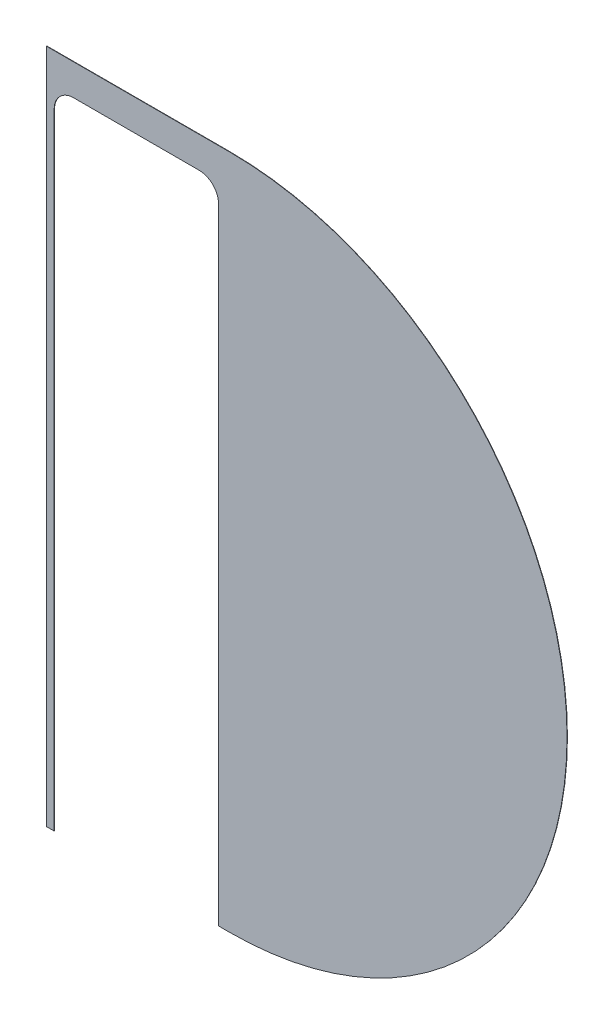
from build123d import *

# Parameters (mm, degrees)
BOSS_EXTRUDE1_DEPTH = 1
CUT_EXTRUDE1_DEPTH  = 2243.543822363


with BuildPart() as part:
    # Sketch1 → Boss-Extrude1 (new body)
    with BuildSketch(Plane.XY):
        with BuildLine():
            Line((0, 0), (470, 0))
            ThreePointArc((470, 0), (1340, 870), (470, 1740))
            Line((470, 1740), (0, 1740))
            Line((0, 1740), (0, 0))
        make_face()
    extrude(amount=BOSS_EXTRUDE1_DEPTH)

    # Sketch2 → Cut-Extrude1 (cut, through all)
    with BuildSketch(Plane(origin=(-149.893544062, 64.252100529, -32), x_dir=(-1, 0, 0), z_dir=(0, 0, -1))):
        with BuildLine():
            Line((-592.773575067, -114.252100529), (-169.572129607, -114.252100529))
            Line((-169.572129607, -114.252100529), (-169.572129607, 1545.594593054))
            ThreePointArc((-169.572129607, 1545.594593054), (-184.216790548, 1580.949932113), (-219.572129607, 1595.594593054))
            Line((-219.572129607, 1595.594593054), (-542.773575067, 1595.594593054))
            ThreePointArc((-542.773575067, 1595.594593054), (-578.128914126, 1580.949932113), (-592.773575067, 1545.594593054))
            Line((-592.773575067, 1545.594593054), (-592.773575067, -114.252100529))
        make_face()
    extrude(amount=-CUT_EXTRUDE1_DEPTH, mode=Mode.SUBTRACT)


solid = part.part
